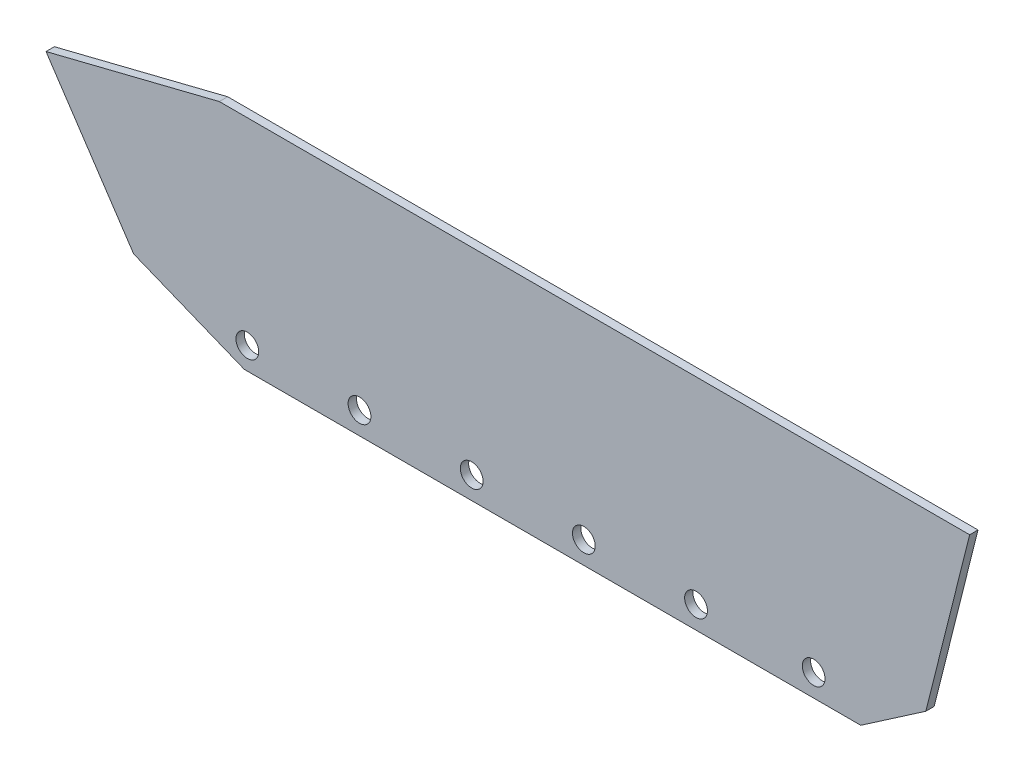
from build123d import *

# Parameters (mm, degrees)
BOSS_EXTRUDE1_DEPTH = 4.7625
SKETCH1_4_R         = 6.5
CUT_EXTRUDE1_DEPTH  = 439.920211962
CUT_EXTRUDE3_DEPTH  = 10


with BuildPart() as part:
    # Sketch1 → Boss-Extrude1 (new body)
    with BuildSketch(Plane.XY):
        Polygon((428.120588235, 28.570833333), (0, 28.570833333), (-98.879411765, 3.850980392), (-31.879411765, -96.649019608), (366, -96.649019608), (403.120588235, -71.149019608), align=None)
    extrude(amount=BOSS_EXTRUDE1_DEPTH)

    # Sketch1<4> → Cut-Extrude1 (cut, through all)
    with BuildSketch(Plane.XY):
        with Locations((16, -83.899019608)):
            Circle(SKETCH1_4_R)
        with Locations((80, -83.899019608)):
            Circle(SKETCH1_4_R)
        with Locations((144, -83.899019608)):
            Circle(SKETCH1_4_R)
        with Locations((208, -83.899019608)):
            Circle(SKETCH1_4_R)
        with Locations((272, -83.899019608)):
            Circle(SKETCH1_4_R)
        with Locations((339.120588235, -83.899019608)):
            Circle(SKETCH1_4_R)
    extrude(amount=CUT_EXTRUDE1_DEPTH, mode=Mode.SUBTRACT)

    # Sketch6 → Cut-Extrude3 (cut)
    with BuildSketch(Plane.XY.offset(4.7625)):
        Polygon((-48.879411765, -71.149019608), (14.235302997, -96.649019608), (-31.879411765, -96.649019608), align=None)
    extrude(amount=-CUT_EXTRUDE3_DEPTH, mode=Mode.SUBTRACT)


solid = part.part
